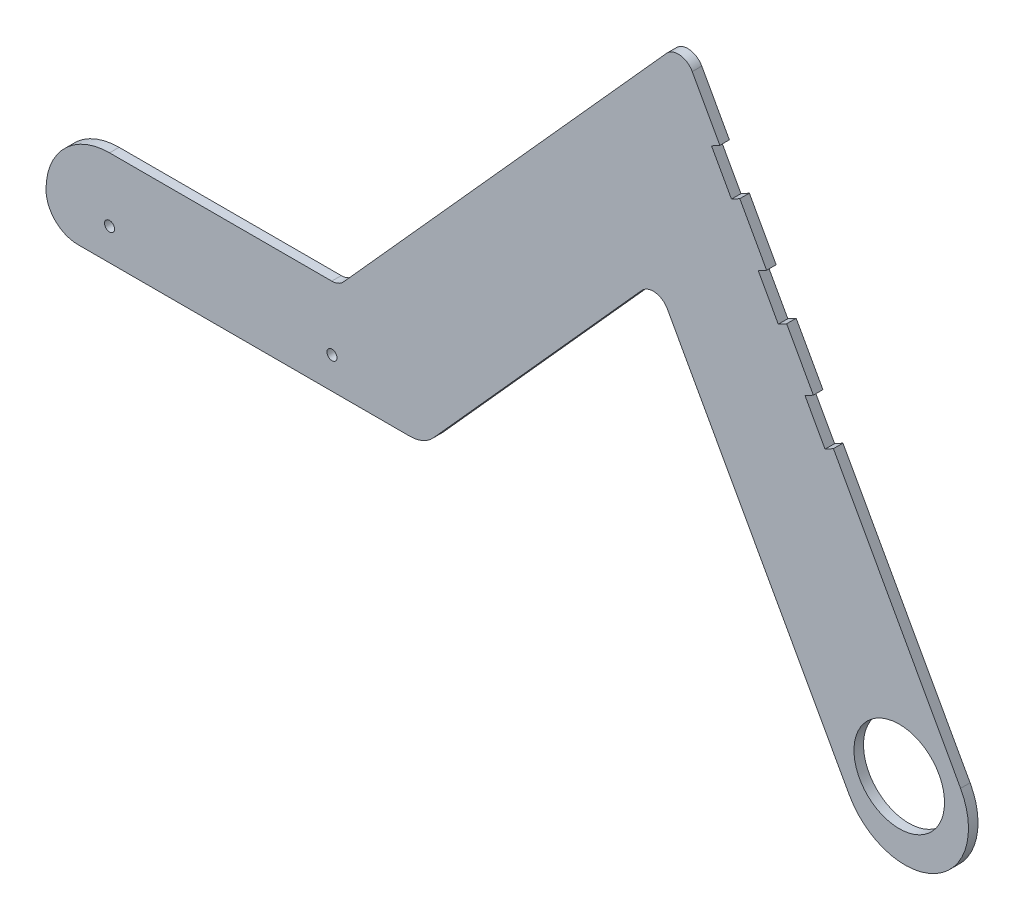
from build123d import *

# Parameters (mm, degrees)
CROQUIS1_R              = 1.58
CROQUIS1_R_2            = 14.25
SALIENTE_EXTRUIR1_DEPTH = 3
CROQUIS3_W              = 3
CROQUIS3_H              = 13.002457907
CROQUIS3_H_2            = 13.048194377
CROQUIS3_H_3            = 13.048194378
CORTAR_EXTRUIR1_DEPTH   = 3
CROQUIS4_W              = 163.675423661
CROQUIS4_H              = 10
CORTAR_EXTRUIR2_DEPTH   = 10
REDONDEO1_R             = 10


with BuildPart() as part:
    # Croquis1 → Saliente-Extruir1 (new body)
    with BuildSketch(Plane.XY):
        with BuildLine():
            Line((-135.811178416, 31.660861846), (-65.873242367, 31.660861846))
            ThreePointArc((-65.873242367, 31.660861846), (-63.837291884, 32.094144685), (-62.154198363, 33.318899594))
            Line((-62.154198363, 33.318899594), (39.488020824, 146.429658271))
            ThreePointArc((39.488020824, 146.429658271), (43.775922453, 148.055230719), (47.585333219, 145.502393908))
            Line((47.585333219, 145.502393908), (132.043103592, -7.634273033))
            ThreePointArc((132.043103592, -7.634273033), (124.188821584, -34.806138154), (97.016956463, -26.951856146))
            Line((97.016956463, -26.951856146), (39.731279169, 76.917067288))
            ThreePointArc((39.731279169, 76.917067288), (35.921868403, 79.4699041), (31.633966774, 77.844331652))
            Line((31.633966774, 77.844331652), (-44.321252629, -6.681100406))
            ThreePointArc((-44.321252629, -6.681100406), (-46.00434615, -7.905855315), (-48.040296633, -8.339138154))
            Line((-48.040296633, -8.339138154), (-135.811178416, -8.339138154))
            ThreePointArc((-135.811178416, -8.339138154), (-155.811178416, 11.660861846), (-135.811178416, 31.660861846))
        make_face()
        with Locations((-135.811178416, 11.660861846)):
            Circle(CROQUIS1_R, mode=Mode.SUBTRACT)
        with Locations((-65.81121578, 11.5885363)):
            Circle(CROQUIS1_R, mode=Mode.SUBTRACT)
        with Locations((112.738617641, -14.044921514)):
            Circle(CROQUIS1_R_2, mode=Mode.SUBTRACT)
    extrude(amount=SALIENTE_EXTRUIR1_DEPTH)

    # Croquis3 → Cortar-Extruir1 (cut)
    with BuildSketch(Plane(origin=(98.018165522, 54.058873563, 0), x_dir=(0, 0, -1), z_dir=(0.875653678217041, 0.4829395778200074, 0))):
        with Locations((-1.5, 79.927636726)):
            Rectangle(CROQUIS3_W, CROQUIS3_H)
        with Locations((-1.5, 49.42886568)):
            Rectangle(CROQUIS3_W, CROQUIS3_H_2)
        with Locations((-1.5, 18.952962868)):
            Rectangle(CROQUIS3_W, CROQUIS3_H_3)
    extrude(amount=-CORTAR_EXTRUIR1_DEPTH, mode=Mode.SUBTRACT)

    # Croquis4 → Cortar-Extruir2 (cut)
    with BuildSketch(Plane.XY.offset(3)):
        with Locations((-95.362453556, -3.339138154)):
            Rectangle(CROQUIS4_W, CROQUIS4_H)
    extrude(amount=-CORTAR_EXTRUIR2_DEPTH, mode=Mode.SUBTRACT)

    # Redondeo1
    redondeo1_edges = [part.edges().sort_by_distance(p)[0] for p in [
        (-36.825099605, 1.660861846, 1.5),
        (-153.131686492, 1.660861846, 1.5),
    ]]
    fillet(redondeo1_edges, radius=REDONDEO1_R)


solid = part.part
